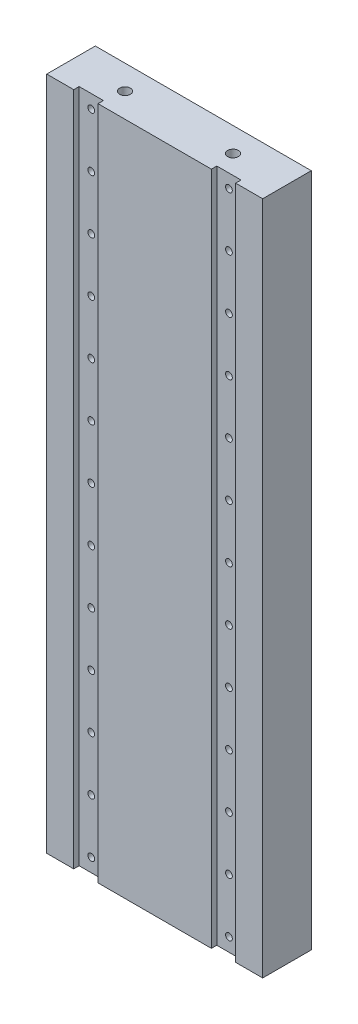
from build123d import *

# Parameters (mm, degrees)
CROQUIS1_W                         = 80
CROQUIS1_H                         = 250
SALIENTE_EXTRUIR1_DEPTH            = 18
CROQUIS2_W                         = 9
CROQUIS2_H                         = 250
CORTAR_EXTRUIR1_DEPTH              = 2
MATRIZL1_COUNT                     = 13
MATRIZL1_PITCH                     = 20
MATRIZL1_COUNT_DIR2                = 2
MATRIZL1_PITCH_DIR2                = 51
TALADROS_DE_ESPIGA_DE_4_0MM1_D     = 4
TALADROS_DE_ESPIGA_DE_4_0MM1_DEPTH = 12
TALADROS_DE_ESPIGA_DE_4_0MM1_TIP   = 1.201721238


with BuildPart() as part:
    # Croquis1 → Saliente-Extruir1 (new body)
    with BuildSketch(Plane.XY):
        with Locations((40, 125)):
            Rectangle(CROQUIS1_W, CROQUIS1_H)
    extrude(amount=SALIENTE_EXTRUIR1_DEPTH)

    # Croquis2 → Cortar-Extruir1 (cut)
    with BuildSketch(Plane.XY.offset(18)):
        with Locations((14.5, 125)):
            Rectangle(CROQUIS2_W, CROQUIS2_H)
        with Locations((65.5, 125)):
            Rectangle(CROQUIS2_W, CROQUIS2_H)
    extrude(amount=-CORTAR_EXTRUIR1_DEPTH, mode=Mode.SUBTRACT)

    # Croquis4 → Taladro roscado M31 (revolve, cut)
    with BuildSketch(Plane(origin=(14.5, 245, 16), x_dir=(0, -1, 0), z_dir=(1, 0, 0))):
        Polygon((0, 0), (0, 10.751075774), (1.25, 10), (1.25, 0), align=None)
    taladro_roscado_m31 = revolve(axis=Axis((14.5, 245, 22.35), (0, 0, -1)), mode=Mode.SUBTRACT)

    # MatrizL1: Taladro roscado M31 13 × 2
    with Locations(*[(j * MATRIZL1_PITCH_DIR2, -i * MATRIZL1_PITCH, 0) for i in range(MATRIZL1_COUNT) for j in range(MATRIZL1_COUNT_DIR2) if (i, j) != (0, 0)]):
        add(taladro_roscado_m31, mode=Mode.SUBTRACT)

    # Taladros de espiga de Ø4.0mm1
    with Locations(Plane(origin=(0, 250, 0), x_dir=(1, 0, 0), z_dir=(0, 1, 0))):
        with Locations((60, -9), (20, -9)):
            Hole(TALADROS_DE_ESPIGA_DE_4_0MM1_D / 2, depth=TALADROS_DE_ESPIGA_DE_4_0MM1_DEPTH)
            with Locations((0, 0, -(TALADROS_DE_ESPIGA_DE_4_0MM1_DEPTH + TALADROS_DE_ESPIGA_DE_4_0MM1_TIP / 2))):  # 118° drill point
                Cone(0, TALADROS_DE_ESPIGA_DE_4_0MM1_D / 2, TALADROS_DE_ESPIGA_DE_4_0MM1_TIP, mode=Mode.SUBTRACT)


solid = part.part
